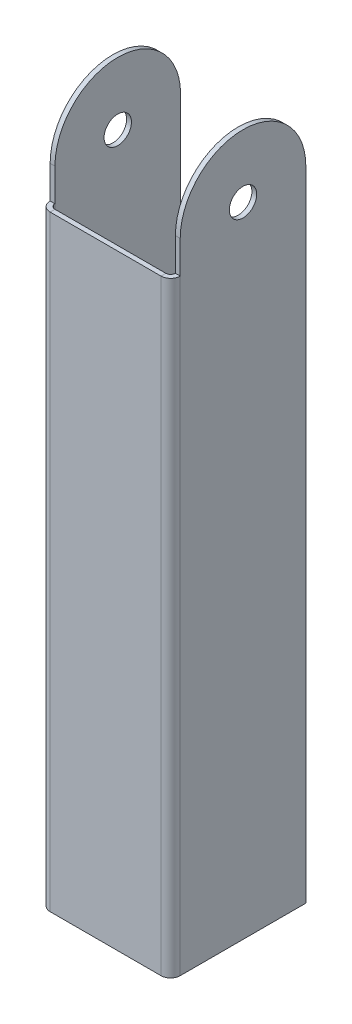
from build123d import *

# Parameters (mm, degrees)
SKETCH1_W               = 15
SKETCH1_H               = 92.922077922
BASE_FLANGE1_DEPTH      = 0.7366
EDGE_FLANGE2_DEPTH      = 92.922077922
EDGE_FLANGE2_BEND_DEPTH = 92.922077922
SKETCH31_R              = 2.1
TAB3_DEPTH              = 0.7366
TAB4_START              = -0.7366
SKETCH35_R              = 2.1
TAB4_DEPTH              = 0.7366


# Sheet-metal steps are written as plain solids
with BuildPart() as part:
    # Sketch1 → Base-Flange1 (new body)
    with BuildSketch(Plane.XY):
        Rectangle(SKETCH1_W, SKETCH1_H)
    extrude(amount=-BASE_FLANGE1_DEPTH)

    # Edge-Flange2 section (across the edge) → Edge-Flange2 (add)
    with BuildSketch(Plane(origin=(9.2366, 46.461038961, -0.7366), x_dir=(-1, 0, 0), z_dir=(0, -1, 0))):
        with BuildLine():
            Line((-0.7366, 0.7366), (-0.7366, 20))
            Line((-0.7366, 20), (0, 20))
            Line((0, 20), (0, 0.7366))
            ThreePointArc((0, 0.7366), (0.215745145, 0.215745145), (0.7366, 0))
            Line((0.7366, 0), (1.7366, 0))
            Line((1.7366, 0), (1.7366, -0.7366))
            Line((1.7366, -0.7366), (0.7366, -0.7366))
            ThreePointArc((0.7366, -0.7366), (-0.30510971, -0.30510971), (-0.7366, 0.7366))
        make_face()
    extrude(amount=EDGE_FLANGE2_DEPTH)

    # Edge-Flange2 section 2 (across the edge) → Edge-Flange2 bend (add)
    with BuildSketch(Plane(origin=(-9.2366, -46.461038961, -0.7366), x_dir=(1, 0, 0), z_dir=(0, 1, 0))):
        with BuildLine():
            Line((-0.7366, 0.7366), (-0.7366, 20))
            Line((-0.7366, 20), (0, 20))
            Line((0, 20), (0, 0.7366))
            ThreePointArc((0, 0.7366), (0.215745145, 0.215745145), (0.7366, 0))
            Line((0.7366, 0), (1.7366, 0))
            Line((1.7366, 0), (1.7366, -0.7366))
            Line((1.7366, -0.7366), (0.7366, -0.7366))
            ThreePointArc((0.7366, -0.7366), (-0.30510971, -0.30510971), (-0.7366, 0.7366))
        make_face()
    extrude(amount=EDGE_FLANGE2_BEND_DEPTH)

    # Sketch31 → Tab3 (add)
    with BuildSketch(Plane(origin=(9.9732, 0, 0), x_dir=(0, 0, -1), z_dir=(1, 0, 0))):
        with BuildLine():
            Line((1.4732, 46.461038961), (1.4732, 51.461038961))
            ThreePointArc((1.4732, 51.461038961), (11.1049, 61.092738961), (20.7366, 51.461038961))
            Line((20.7366, 51.461038961), (20.7366, 46.461038961))
            Line((20.7366, 46.461038961), (1.4732, 46.461038961))
        make_face()
        with Locations((11.1049, 51.461038961)):
            Circle(SKETCH31_R, mode=Mode.SUBTRACT)
    extrude(amount=-TAB3_DEPTH)

    # Sketch35 → Tab4 (add)
    with BuildSketch(Plane.ZY.offset(9.9732).offset(TAB4_START)):
        with BuildLine():
            Line((-20.7366, 46.461038961), (-20.7366, 51.461038961))
            ThreePointArc((-20.7366, 51.461038961), (-11.1049, 61.092738961), (-1.4732, 51.461038961))
            Line((-1.4732, 51.461038961), (-1.4732, 46.461038961))
            Line((-1.4732, 46.461038961), (-20.7366, 46.461038961))
        make_face()
        with Locations(Location((-11.1049, 51.461038961, 0), (0, 0, 180))):
            Circle(SKETCH35_R, mode=Mode.SUBTRACT)
    extrude(amount=TAB4_DEPTH)


solid = part.part
